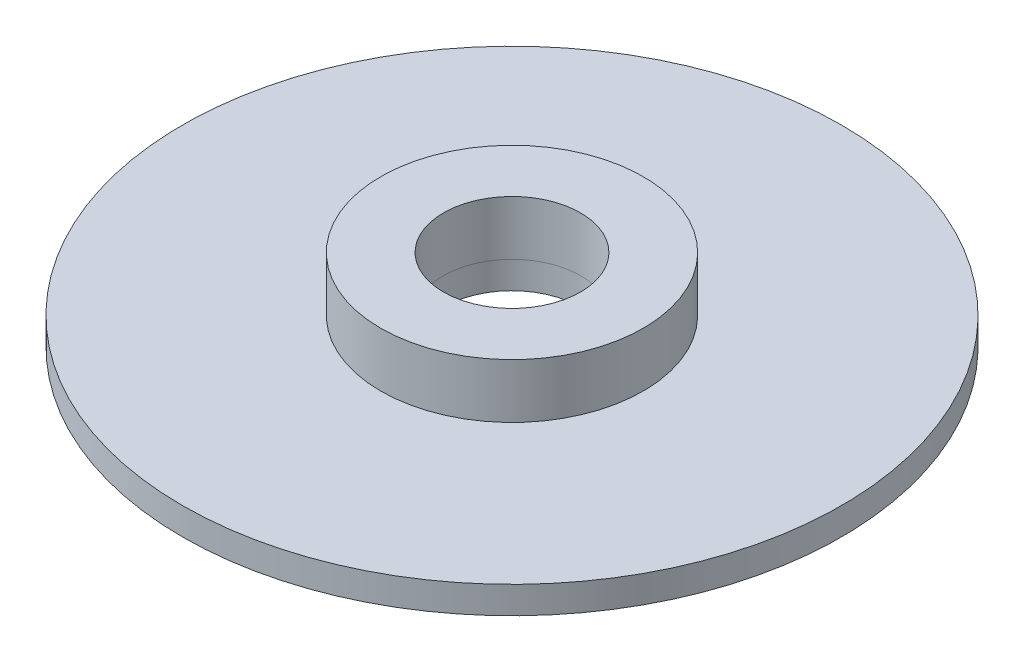
from build123d import *

# Parameters (mm, degrees)
SKETCH1_R           = 38.45
SKETCH1_R_2         = 8.001
SKETCH1_R_3         = 1.8542
BOSS_EXTRUDE1_DEPTH = 3.175
SKETCH2_R           = 15.318722946
SKETCH2_R_2         = 8.001
BOSS_EXTRUDE2_DEPTH = 6.35


with BuildPart() as part:
    # Sketch1 → Boss-Extrude1 (new body)
    with BuildSketch(Plane(origin=(0, 1054.463973352, 0), x_dir=(-1, 0, 0), z_dir=(0, 1, 0))):
        with Locations((1.204093701, -633.11487505)):
            Circle(SKETCH1_R)
        with Locations((1.204093701, -633.11487505)):
            Circle(SKETCH1_R_2, mode=Mode.SUBTRACT)
        with Locations((10.336534073, -639.988260885)):
            Circle(SKETCH1_R_3, mode=Mode.SUBTRACT)
        with Locations((-2.510805411, -643.924335008)):
            Circle(SKETCH1_R_3, mode=Mode.SUBTRACT)
        with Locations((-10.224280588, -632.922102869)):
            Circle(SKETCH1_R_3, mode=Mode.SUBTRACT)
        with Locations((10.563151363, -626.553401155)):
            Circle(SKETCH1_R_3, mode=Mode.SUBTRACT)
        with Locations((-2.144130934, -622.186275332)):
            Circle(SKETCH1_R_3, mode=Mode.SUBTRACT)
    extrude(amount=-BOSS_EXTRUDE1_DEPTH)


with BuildPart() as body_2:
    # Sketch2 → Boss-Extrude2 (new body)
    with BuildSketch(Plane(origin=(0, 1054.463973352, 0), x_dir=(1, 0, 0), z_dir=(0, 1, 0))):
        with Locations((-1.204093701, 633.11487505)):
            Circle(SKETCH2_R)
        with Locations((-1.204093701, 633.11487505)):
            Circle(SKETCH2_R_2, mode=Mode.SUBTRACT)
    extrude(amount=BOSS_EXTRUDE2_DEPTH)


solid = Compound([part.part, body_2.part])
